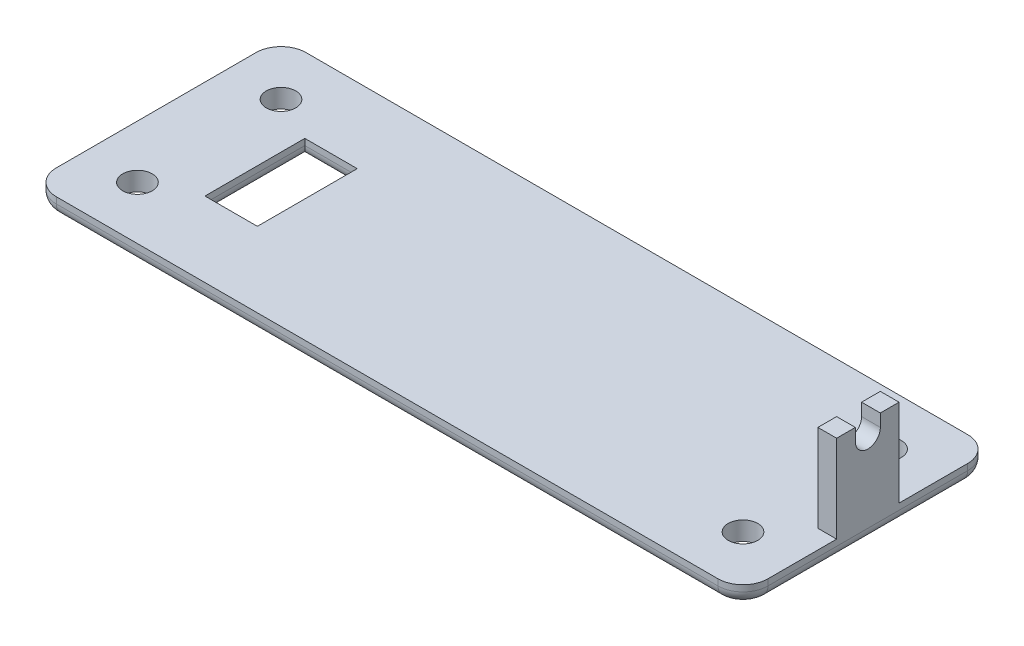
from build123d import *

# Parameters (mm, degrees)
SKETCH1_W           = 144.78
SKETCH1_H           = 50.8
BOSS_EXTRUDE1_DEPTH = 3.81
SKETCH2_W           = 3.81
SKETCH2_H           = 12.7
BOSS_EXTRUDE2_DEPTH = 17.78
CUT_EXTRUDE1_REACH  = 150.568
SKETCH4_W           = 10.668
SKETCH4_H           = 20.32
CUT_EXTRUDE2_DEPTH  = 80.696927168
SKETCH5_R           = 3
CUT_EXTRUDE3_DEPTH  = 80.696927168
FILLET3_R           = 5.08
FILLET4_R           = 2.54


with BuildPart() as part:
    # Sketch1 → Boss-Extrude1 (new body)
    with BuildSketch(Plane(origin=(0, 0, 0), x_dir=(1, 0, 0), z_dir=(0, 1, 0))):
        Rectangle(SKETCH1_W, SKETCH1_H)
    extrude(amount=BOSS_EXTRUDE1_DEPTH)

    # Sketch2 → Boss-Extrude2 (add)
    with BuildSketch(Plane(origin=(0, 3.81, 0), x_dir=(1, 0, 0), z_dir=(0, 1, 0))):
        with Locations((70.485, 0)):
            Rectangle(SKETCH2_W, SKETCH2_H)
    extrude(amount=BOSS_EXTRUDE2_DEPTH)

    # Sketch3 → Cut-Extrude1 (cut, up to next)
    with BuildSketch(Plane(origin=(72.39, 0, 0), x_dir=(0, 0, -1), z_dir=(1, 0, 0)), mode=Mode.PRIVATE) as cut_extrude1_sk1:
        with BuildLine():
            Line((-2.54, 21.59), (2.54, 21.59))
            Line((2.54, 21.59), (2.54, 19.05))
            ThreePointArc((2.54, 19.05), (0, 16.51), (-2.54, 19.05))
            Line((-2.54, 19.05), (-2.54, 21.59))
        make_face()
    cut_extrude1_tool1 = extrude(cut_extrude1_sk1.sketch, amount=-CUT_EXTRUDE1_REACH, mode=Mode.PRIVATE) & part.part
    add(cut_extrude1_tool1.solids().sort_by_distance((72.39, 19.287109, 0))[0], mode=Mode.SUBTRACT)

    # Sketch4 → Cut-Extrude2 (cut, through all)
    with BuildSketch(Plane.XZ):
        with Locations((-46.976, 0)):
            Rectangle(SKETCH4_W, SKETCH4_H)
    extrude(amount=-CUT_EXTRUDE2_DEPTH, mode=Mode.SUBTRACT)

    # Sketch5 → Cut-Extrude3 (cut, through all)
    with BuildSketch(Plane.XZ):
        with Locations((61.595, -14.605)):
            Circle(SKETCH5_R)
        with Locations((61.595, 14.605)):
            Circle(SKETCH5_R)
        with Locations((-61.595, 14.605)):
            Circle(SKETCH5_R)
        with Locations((-61.595, -14.605)):
            Circle(SKETCH5_R)
    extrude(amount=-CUT_EXTRUDE3_DEPTH, mode=Mode.SUBTRACT)

    # Fillet3
    fillet3_edges = [part.edges().sort_by_distance(p)[0] for p in [
        (-72.39, 1.905, -25.4),
        (-72.39, 1.905, 25.4),
        (72.39, 1.905, 25.4),
        (72.39, 1.905, -25.4),
    ]]
    fillet(fillet3_edges, radius=FILLET3_R)

    # Fillet4
    fillet4_edges = [part.edges().sort_by_distance(p)[0] for p in [
        (-72.39, 0, 0),
        (-70.902102448, 0, 23.912102448),
        (0, 0, 25.4),
        (70.902102448, 0, 23.912102448),
        (72.39, 0, 0),
        (70.902102448, 0, -23.912102448),
        (0, 0, -25.4),
        (-46.976, 0, 10.16),
        (-52.31, 0, 0),
        (-46.976, 0, -10.16),
        (-41.642, 0, 0),
        (-70.902102448, 0, -23.912102448),
    ]]
    fillet(fillet4_edges, radius=FILLET4_R)


solid = part.part
